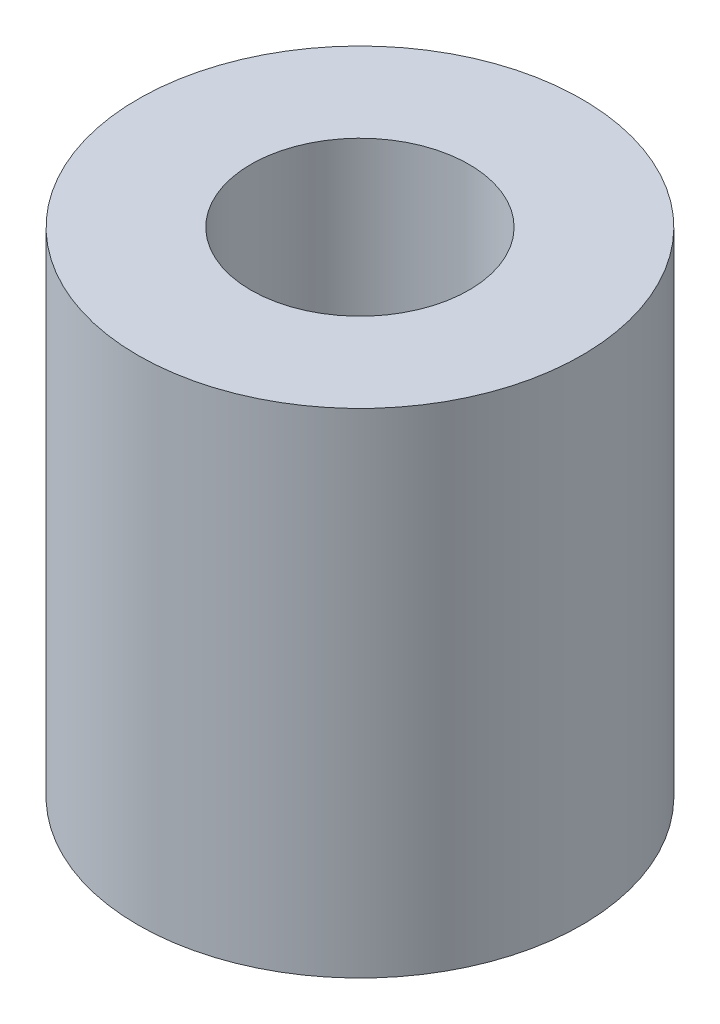
from build123d import *

# Parameters (mm, degrees)
SKETCH1_R           = 10
BOSS_EXTRUDE1_DEPTH = 22.225
SKETCH2_R           = 4.9125
CUT_EXTRUDE1_DEPTH  = 27.342942603


with BuildPart() as part:
    # Sketch1 → Boss-Extrude1 (new body)
    with BuildSketch(Plane(origin=(0, 0, 0), x_dir=(1, 0, 0), z_dir=(0, 1, 0))):
        Circle(SKETCH1_R)
    extrude(amount=BOSS_EXTRUDE1_DEPTH)

    # Sketch2 → Cut-Extrude1 (cut, through all)
    with BuildSketch(Plane(origin=(0, 22.225, 0), x_dir=(1, 0, 0), z_dir=(0, 1, 0))):
        Circle(SKETCH2_R)
    extrude(amount=-CUT_EXTRUDE1_DEPTH, mode=Mode.SUBTRACT)


solid = part.part
